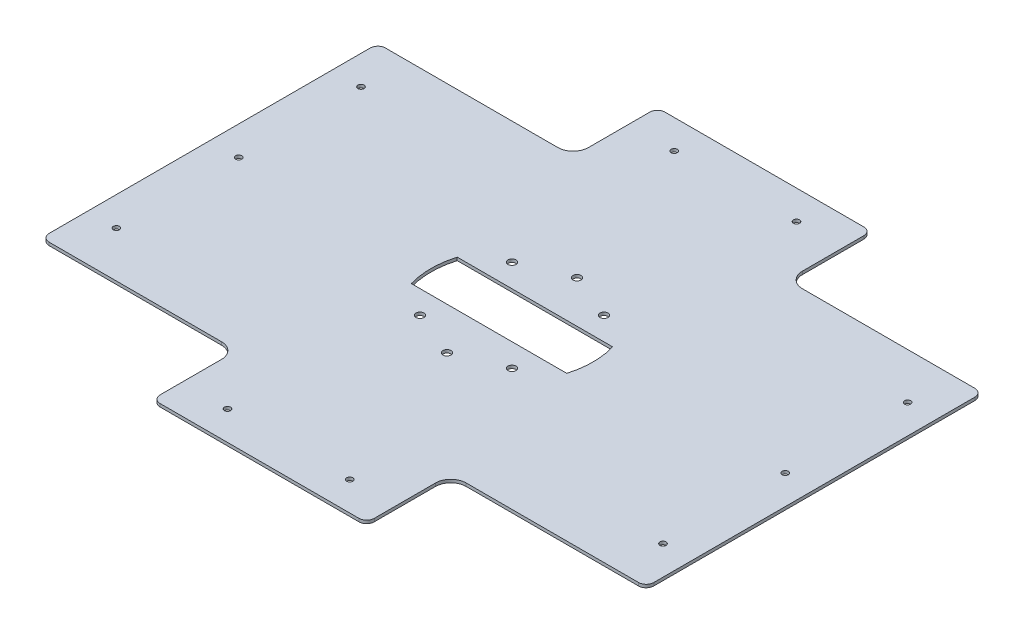
from build123d import *

# Parameters (mm, degrees)
SKETCH_1_R          = 2
EXTRUDE_1_DEPTH     = 2
SKETCH_4_R          = 2.6
CUT_EXTRUDE_1_DEPTH = 258.635154254
CUT_EXTRUDE_2_DEPTH = 258.635154254


with BuildPart() as part:
    # Эскиз1 → Бобышка-Вытянуть1 (new body)
    with BuildSketch(Plane(origin=(0, 0, 0), x_dir=(1, 0, 0), z_dir=(0, 1, 0))):
        with BuildLine():
            ThreePointArc((-70, -160.104291208), (-68.535533906, -163.639825114), (-65, -165.104291208))
            Line((-65, -165.104291208), (65, -165.104291208))
            ThreePointArc((65, -165.104291208), (68.535533906, -163.639825114), (70, -160.104291208))
            Line((70, -160.104291208), (70, -120))
            ThreePointArc((70, -120), (72.928932188, -112.928932188), (80, -110))
            Line((80, -110), (134.901841239, -110))
            Line((134.901841239, -110), (160.901841239, -110))
            Line((160.901841239, -110), (192.768667216, -110))
            ThreePointArc((192.768667216, -110), (196.304201122, -108.535533906), (197.768667216, -105))
            Line((197.768667216, -105), (197.768667216, 105))
            ThreePointArc((197.768667216, 105), (196.304201122, 108.535533906), (192.768667216, 110))
            Line((192.768667216, 110), (160.901841239, 110))
            Line((160.901841239, 110), (134.901841239, 110))
            Line((134.901841239, 110), (80, 110))
            ThreePointArc((80, 110), (72.928932188, 112.928932188), (70, 120))
            Line((70, 120), (70, 160.104291208))
            ThreePointArc((70, 160.104291208), (68.535533906, 163.639825114), (65, 165.104291208))
            Line((65, 165.104291208), (-65, 165.104291208))
            ThreePointArc((-65, 165.104291208), (-68.535533906, 163.639825114), (-70, 160.104291208))
            Line((-70, 160.104291208), (-70, 120))
            ThreePointArc((-70, 120), (-72.928932188, 112.928932188), (-80, 110))
            Line((-80, 110), (-192.768667216, 110))
            ThreePointArc((-192.768667216, 110), (-196.304201122, 108.535533906), (-197.768667216, 105))
            Line((-197.768667216, 105), (-197.768667216, -105))
            ThreePointArc((-197.768667216, -105), (-196.304201122, -108.535533906), (-192.768667216, -110))
            Line((-192.768667216, -110), (-80, -110))
            ThreePointArc((-80, -110), (-72.928932188, -112.928932188), (-70, -120))
            Line((-70, -120), (-70, -160.104291208))
        make_face()
        with Locations((-40, -146.104291208)):
            Circle(SKETCH_1_R, mode=Mode.SUBTRACT)
        with Locations((-178.768667216, -80)):
            Circle(SKETCH_1_R, mode=Mode.SUBTRACT)
        with Locations((-178.768667216, 0)):
            Circle(SKETCH_1_R, mode=Mode.SUBTRACT)
        with Locations((40, -146.104291208)):
            Circle(SKETCH_1_R, mode=Mode.SUBTRACT)
        with Locations((178.768667216, -80)):
            Circle(SKETCH_1_R, mode=Mode.SUBTRACT)
        with Locations((-178.768667216, 80)):
            Circle(SKETCH_1_R, mode=Mode.SUBTRACT)
        with Locations((-40, 146.104291208)):
            Circle(SKETCH_1_R, mode=Mode.SUBTRACT)
        with Locations((178.768667216, 0)):
            Circle(SKETCH_1_R, mode=Mode.SUBTRACT)
        with Locations((178.768667216, 80)):
            Circle(SKETCH_1_R, mode=Mode.SUBTRACT)
        with Locations((40, 146.104291208)):
            Circle(SKETCH_1_R, mode=Mode.SUBTRACT)
    extrude(amount=EXTRUDE_1_DEPTH)

    # Эскиз4 → Вырез-Вытянуть1 (cut, through all)
    with BuildSketch(Plane(origin=(0, 2, 0), x_dir=(1, 0, 0), z_dir=(0, 1, 0))):
        with Locations((0, 42.54)):
            Circle(SKETCH_4_R)
        with Locations((0, -42.54)):
            Circle(SKETCH_4_R)
        with Locations((30.080322472, 30.080322472)):
            Circle(SKETCH_4_R)
        with Locations((-30.080322472, -30.080322472)):
            Circle(SKETCH_4_R)
        with Locations((-30.080322472, 30.080322472)):
            Circle(SKETCH_4_R)
        with Locations((30.080322472, -30.080322472)):
            Circle(SKETCH_4_R)
    extrude(amount=-CUT_EXTRUDE_1_DEPTH, mode=Mode.SUBTRACT)

    # Эскиз5 → Вырез-Вытянуть2 (cut, through all)
    with BuildSketch(Plane.XZ):
        with BuildLine():
            Line((50.833060109, -15), (-50.833060109, -15))
            ThreePointArc((-50.833060109, -15), (-53, 0), (-50.833060109, 15))
            Line((-50.833060109, 15), (50.833060109, 15))
            ThreePointArc((50.833060109, 15), (53, 0), (50.833060109, -15))
        make_face()
    extrude(amount=-CUT_EXTRUDE_2_DEPTH, mode=Mode.SUBTRACT)


solid = part.part
